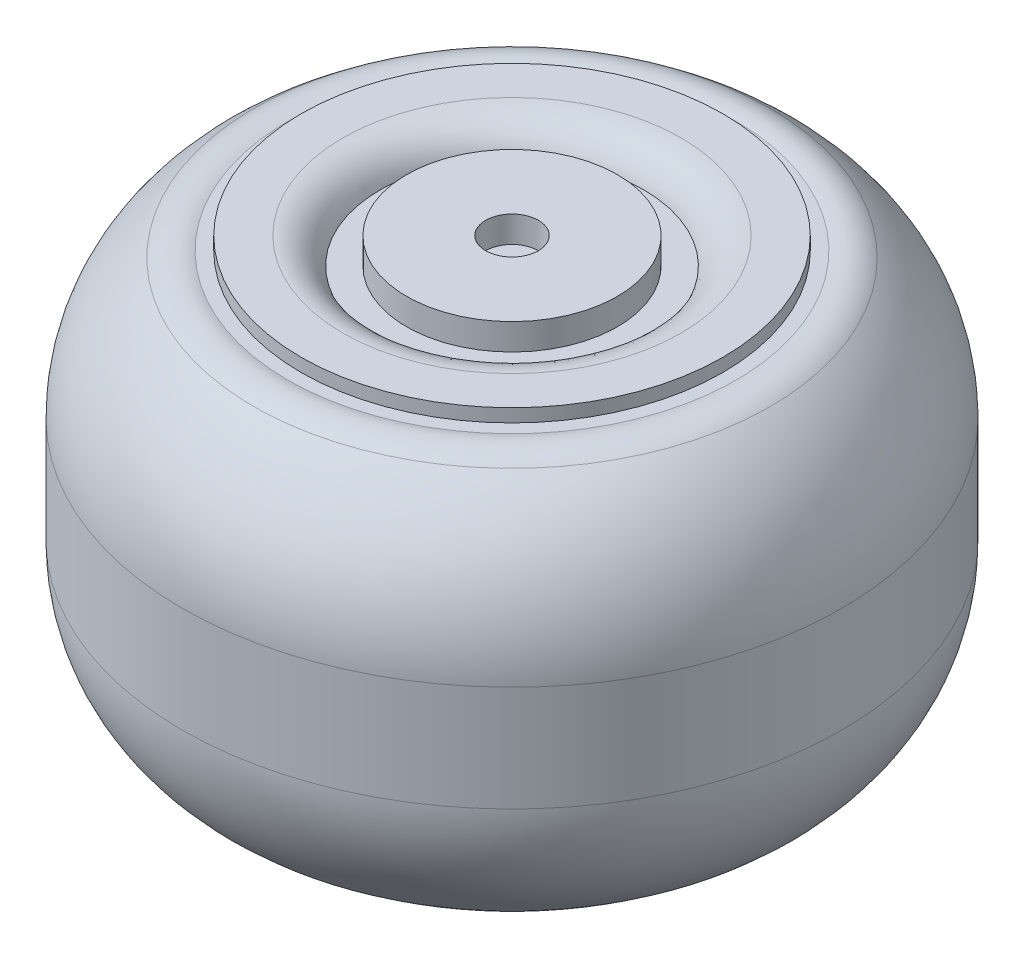
from build123d import *

# Parameters (mm, degrees)
FILLET_1_R = 13
FILLET_3_R = 3
FILLET_4_R = 3


with BuildPart() as part:
    # 草图1 → 旋转1 (revolve)
    with BuildSketch(Plane(origin=(0, 0, 0), x_dir=(0, 0, -1), z_dir=(1, 0, 0)), mode=Mode.PRIVATE) as revolve_1_sk:
        Polygon((17, 32), (23, 32), (23, 30), (25, 30), (25, 2), (23, 2), (23, 0), (17, 0), (17, 2), (15, 2), (15, 0), (9, 0), (9, 1), (8, 1), (8, 0), (0, 0), (0, 32), (8, 32), (8, 31), (9, 31), (9, 32), (15, 32), (15, 30), (17, 30), align=None)
    revolve(revolve_1_sk.sketch.rotate(Axis((0, 2, -25), (0, 1, 0)), 180), axis=Axis((0, 2, -25), (0, 1, 0)))

    # 圆角1
    # the kernel refuses this fillet: 13 mm, written as the material it takes off along each edge
    with BuildSketch(Plane(origin=(0, 0, -25), x_dir=(0, 0, -1), z_dir=(1, 0, 0))) as fillet_1_piece_1:
        with BuildLine():
            CenterArc((12, 12), FILLET_1_R, 292.619864948, 67.380135052)
            Line((25, 12), (25.26, 12))
            Line((25.26, 12), (25.26, 0))
            Line((25.26, 0), (25, -0.26))
            ThreePointArc((25, -0.26), (21, -0.26), (17.1, -0.24))
            Line((17.1, -0.24), (17, 0))
        make_face()
    revolve(axis=Axis((0, 0, -25), (0, 1, 0)), mode=Mode.SUBTRACT)
    with BuildSketch(Plane(origin=(0, 32, -25), x_dir=(0, 0, -1), z_dir=(1, 0, 0))) as fillet_1_piece_2:
        with BuildLine():
            CenterArc((12, -12), FILLET_1_R, 0, 67.380135052)
            Line((17, 0), (17.1, 0.24))
            ThreePointArc((17.1, 0.24), (21, 0.26), (25, 0.26))
            Line((25, 0.26), (25.26, 0))
            Line((25.26, 0), (25.26, -12))
            Line((25.26, -12), (25, -12))
        make_face()
    revolve(axis=Axis((0, 32, -25), (0, 1, 0)), mode=Mode.SUBTRACT)

    # 圆角3
    # the kernel refuses this fillet: 3 mm, written as the material it takes off along each edge
    with BuildSketch(Plane(origin=(0, 32, -25), x_dir=(0, 0, -1), z_dir=(1, 0, 0))) as fillet_3_piece_1:
        with BuildLine():
            CenterArc((12.828427125, -3), FILLET_3_R, 90, 70.528779366)
            Line((12.828427125, 0), (12.828427125, 0.06))
            Line((12.828427125, 0.06), (10, 0.06))
            Line((10, 0.06), (9.94, 0))
            ThreePointArc((9.94, 0), (9.94, -1), (9.943431458, -1.98))
            Line((9.943431458, -1.98), (10, -2))
        make_face()
    revolve(axis=Axis((0, 32, -25), (0, 1, 0)), mode=Mode.SUBTRACT)

    # 圆角4
    # the kernel refuses this fillet: 3 mm, written as the material it takes off along each edge
    with BuildSketch(Plane(origin=(0, 32, -25), x_dir=(0, 0, -1), z_dir=(1, 0, 0))) as fillet_4_piece_1:
        with BuildLine():
            CenterArc((17.837561952, -3.880709978), FILLET_4_R, 54.28483058, 51.926876677)
            Line((19.588830537, -1.444922971), (19.623855909, -1.396207231))
            ThreePointArc((19.623855909, -1.396207231), (18.364982894, -0.596027325), (17.023076923, 0.055384615))
            Line((17.023076923, 0.055384615), (16.94, 0))
            ThreePointArc((16.94, 0), (16.94, -0.5), (16.983248761, -0.9423858))
            Line((16.983248761, -0.9423858), (17, -1))
        make_face()
    revolve(axis=Axis((0, 32, -25), (0, 1, 0)), mode=Mode.SUBTRACT)


solid = part.part
